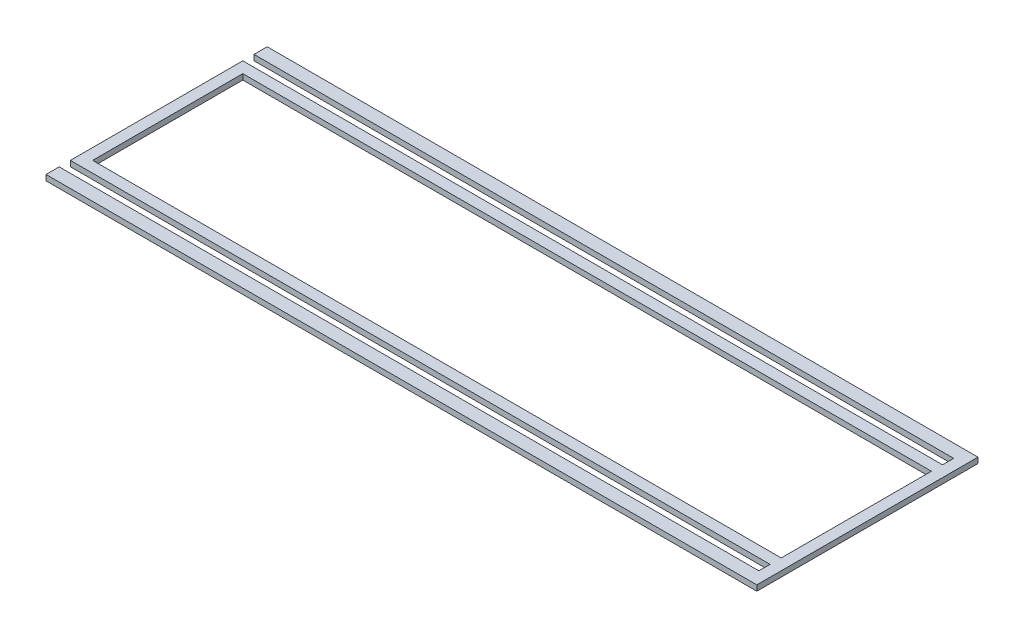
from build123d import *

# Parameters (mm, degrees)
SKETCH1_W           = 393.7
SKETCH1_H           = 85.87105
BOSS_EXTRUDE1_DEPTH = 1.5875


with BuildPart() as part:
    # Sketch1 → Boss-Extrude1 (new, symmetric)
    with BuildSketch(Plane(origin=(0, 0, 0), x_dir=(1, 0, 0), z_dir=(0, 1, 0))):
        Polygon((196.85, 49.285525), (-203.2, 49.285525), (-203.2, -49.285525), (196.85, -49.285525), (196.85, -55.686325), (-203.2, -55.686325), (-203.2, -63.22695), (190.5, -63.22695), (203.2, -63.22695), (203.2, 63.22695), (190.5, 63.22695), (-203.2, 63.22695), (-203.2, 55.686325), (196.85, 55.686325), align=None)
        Rectangle(SKETCH1_W, SKETCH1_H, mode=Mode.SUBTRACT)
    extrude(amount=BOSS_EXTRUDE1_DEPTH, both=True)


solid = part.part
